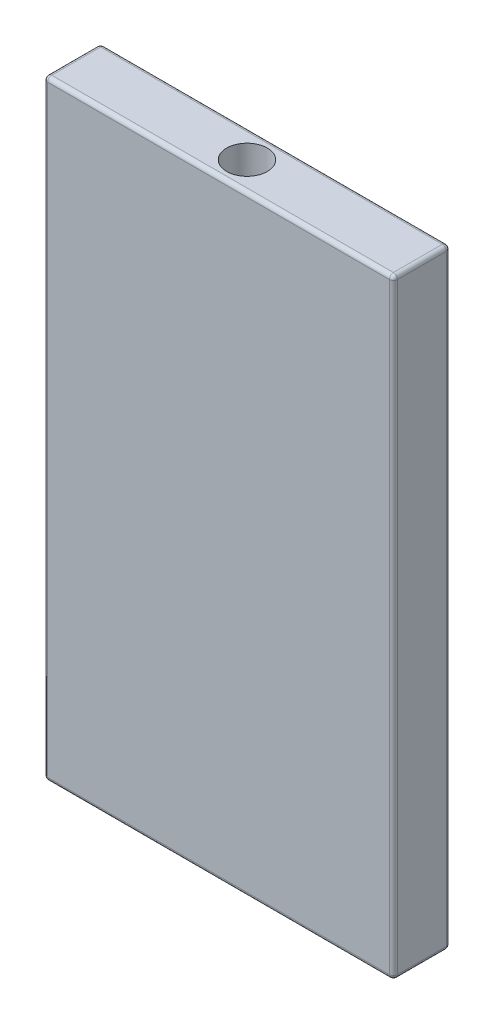
from build123d import *

# Parameters (mm, degrees)
SKETCH1_W           = 43
SKETCH1_H           = 75
BOSS_EXTRUDE1_DEPTH = 7
CUT_EXTRUDE1_REACH  = 80.334
SKETCH2_R           = 2.5
FILLET1_R           = 0.5
FILLET2_R           = 0.5


with BuildPart() as part:
    # Sketch1 → Boss-Extrude1 (new body)
    with BuildSketch(Plane.XY):
        Rectangle(SKETCH1_W, SKETCH1_H)
    extrude(amount=BOSS_EXTRUDE1_DEPTH)

    # Sketch2 → Cut-Extrude1 (cut, up to next)
    with BuildSketch(Plane(origin=(0, 37.5, 0), x_dir=(1, 0, 0), z_dir=(0, 1, 0)), mode=Mode.PRIVATE) as cut_extrude1_sk1:
        with Locations(Location((0, -3.5, 0), (0, 0, 270))):
            Circle(SKETCH2_R)
    cut_extrude1_tool1 = extrude(cut_extrude1_sk1.sketch, amount=-CUT_EXTRUDE1_REACH, mode=Mode.PRIVATE) & part.part
    add(cut_extrude1_tool1.solids().sort_by_distance((0, 37.5, 3.5))[0], mode=Mode.SUBTRACT)

    # Fillet1
    fillet1_edges = [part.edges().sort_by_distance(p)[0] for p in [
        (-21.5, 0, 7),
        (0, -37.5, 7),
        (21.5, 0, 7),
        (0, -37.5, 0),
        (-21.5, 0, 0),
        (0, 37.5, 0),
        (21.5, 0, 0),
        (0, 37.5, 7),
    ]]
    fillet(fillet1_edges, radius=FILLET1_R)

    # Fillet2
    # the kernel refuses this fillet: 0.5 mm, written as the material it takes off along each edge
    with BuildSketch(Plane(origin=(-21, -37, 6.5), x_dir=(0, -1, 0), z_dir=(-1, 0, 0))) as fillet2_piece_1_section:
        Polygon((0, 0), (FILLET2_R, 0), (FILLET2_R, FILLET2_R), (0, FILLET2_R), align=None)
    fillet2_piece_1 = extrude(amount=FILLET2_R, mode=Mode.PRIVATE)
    fillet2_piece_1 = fillet2_piece_1 - Plane(origin=(-21, -37, 6.5), x_dir=(0, 0.7071067811865475, -0.7071067811865475), z_dir=(-1, 0, 0)) * Sphere(FILLET2_R, mode=Mode.PRIVATE)
    add(fillet2_piece_1, mode=Mode.SUBTRACT)
    with BuildSketch(Plane(origin=(-21, 37, 6.5), x_dir=(-1, 0, 0), z_dir=(0, 1, 0))) as fillet2_piece_2_section:
        Polygon((0, 0), (FILLET2_R, 0), (FILLET2_R, FILLET2_R), (0, FILLET2_R), align=None)
    fillet2_piece_2 = extrude(amount=FILLET2_R, mode=Mode.PRIVATE)
    fillet2_piece_2 = fillet2_piece_2 - Plane(origin=(-21, 37, 6.5), x_dir=(0.7071067811865475, 0, -0.7071067811865475), z_dir=(0, 1, 0)) * Sphere(FILLET2_R, mode=Mode.PRIVATE)
    add(fillet2_piece_2, mode=Mode.SUBTRACT)
    with BuildSketch(Plane(origin=(21, -37, 6.5), x_dir=(0, -1, 0), z_dir=(1, 0, 0))) as fillet2_piece_3_section:
        Polygon((0, 0), (FILLET2_R, 0), (FILLET2_R, -FILLET2_R), (0, -FILLET2_R), align=None)
    fillet2_piece_3 = extrude(amount=FILLET2_R, mode=Mode.PRIVATE)
    fillet2_piece_3 = fillet2_piece_3 - Plane(origin=(21, -37, 6.5), x_dir=(0, 0.7071067811865475, -0.7071067811865475), z_dir=(1, 0, 0)) * Sphere(FILLET2_R, mode=Mode.PRIVATE)
    add(fillet2_piece_3, mode=Mode.SUBTRACT)
    with BuildSketch(Plane(origin=(21, 37, 6.5), x_dir=(1, 0, 0), z_dir=(0, 1, 0))) as fillet2_piece_4_section:
        Polygon((0, 0), (FILLET2_R, 0), (FILLET2_R, -FILLET2_R), (0, -FILLET2_R), align=None)
    fillet2_piece_4 = extrude(amount=FILLET2_R, mode=Mode.PRIVATE)
    fillet2_piece_4 = fillet2_piece_4 - Plane(origin=(21, 37, 6.5), x_dir=(-0.7071067811865475, 0, -0.7071067811865475), z_dir=(0, 1, 0)) * Sphere(FILLET2_R, mode=Mode.PRIVATE)
    add(fillet2_piece_4, mode=Mode.SUBTRACT)
    with BuildSketch(Plane(origin=(21, -37, 0.5), x_dir=(0, -1, 0), z_dir=(1, 0, 0))) as fillet2_piece_5_section:
        Polygon((0, 0), (FILLET2_R, 0), (FILLET2_R, FILLET2_R), (0, FILLET2_R), align=None)
    fillet2_piece_5 = extrude(amount=FILLET2_R, mode=Mode.PRIVATE)
    fillet2_piece_5 = fillet2_piece_5 - Plane(origin=(21, -37, 0.5), x_dir=(0, 0.7071067811865475, 0.7071067811865475), z_dir=(1, 0, 0)) * Sphere(FILLET2_R, mode=Mode.PRIVATE)
    add(fillet2_piece_5, mode=Mode.SUBTRACT)
    with BuildSketch(Plane(origin=(-21, -37, 0.5), x_dir=(0, -1, 0), z_dir=(-1, 0, 0))) as fillet2_piece_6_section:
        Polygon((0, 0), (FILLET2_R, 0), (FILLET2_R, -FILLET2_R), (0, -FILLET2_R), align=None)
    fillet2_piece_6 = extrude(amount=FILLET2_R, mode=Mode.PRIVATE)
    fillet2_piece_6 = fillet2_piece_6 - Plane(origin=(-21, -37, 0.5), x_dir=(0, 0.7071067811865475, 0.7071067811865475), z_dir=(-1, 0, 0)) * Sphere(FILLET2_R, mode=Mode.PRIVATE)
    add(fillet2_piece_6, mode=Mode.SUBTRACT)
    with BuildSketch(Plane(origin=(21, 37, 0.5), x_dir=(1, 0, 0), z_dir=(0, 1, 0))) as fillet2_piece_7_section:
        Polygon((0, 0), (FILLET2_R, 0), (FILLET2_R, FILLET2_R), (0, FILLET2_R), align=None)
    fillet2_piece_7 = extrude(amount=FILLET2_R, mode=Mode.PRIVATE)
    fillet2_piece_7 = fillet2_piece_7 - Plane(origin=(21, 37, 0.5), x_dir=(-0.7071067811865475, 0, 0.7071067811865475), z_dir=(0, 1, 0)) * Sphere(FILLET2_R, mode=Mode.PRIVATE)
    add(fillet2_piece_7, mode=Mode.SUBTRACT)
    with BuildSketch(Plane(origin=(-21, 37, 0.5), x_dir=(-1, 0, 0), z_dir=(0, 1, 0))) as fillet2_piece_8_section:
        Polygon((0, 0), (FILLET2_R, 0), (FILLET2_R, -FILLET2_R), (0, -FILLET2_R), align=None)
    fillet2_piece_8 = extrude(amount=FILLET2_R, mode=Mode.PRIVATE)
    fillet2_piece_8 = fillet2_piece_8 - Plane(origin=(-21, 37, 0.5), x_dir=(0.7071067811865475, 0, 0.7071067811865475), z_dir=(0, 1, 0)) * Sphere(FILLET2_R, mode=Mode.PRIVATE)
    add(fillet2_piece_8, mode=Mode.SUBTRACT)
    with BuildSketch(Plane(origin=(21.5, 37.5, 0.5), x_dir=(-1, 0, 0), z_dir=(0, 0, 1)), Plane(origin=(21.5, -37.5, 0.5), x_dir=(0, 1, 0), z_dir=(0, 0, 1))) as fillet2_piece_9:
        with BuildLine():
            CenterArc((FILLET2_R, FILLET2_R), FILLET2_R, 180, 90)
            Line((0, FILLET2_R), (0, 0))
            Line((0, 0), (FILLET2_R, 0))
        make_face()
    extrude(amount=6, mode=Mode.SUBTRACT)
    with BuildSketch(Plane(origin=(-21.5, -37.5, 0.5), x_dir=(0, 1, 0), z_dir=(0, 0, 1)), Plane(origin=(-21.5, 37.5, 0.5), x_dir=(1, 0, 0), z_dir=(0, 0, 1))) as fillet2_piece_10:
        with BuildLine():
            CenterArc((FILLET2_R, -FILLET2_R), FILLET2_R, 90, 90)
            Line((0, -FILLET2_R), (0, 0))
            Line((0, 0), (FILLET2_R, 0))
        make_face()
    extrude(amount=6, mode=Mode.SUBTRACT)


solid = part.part
